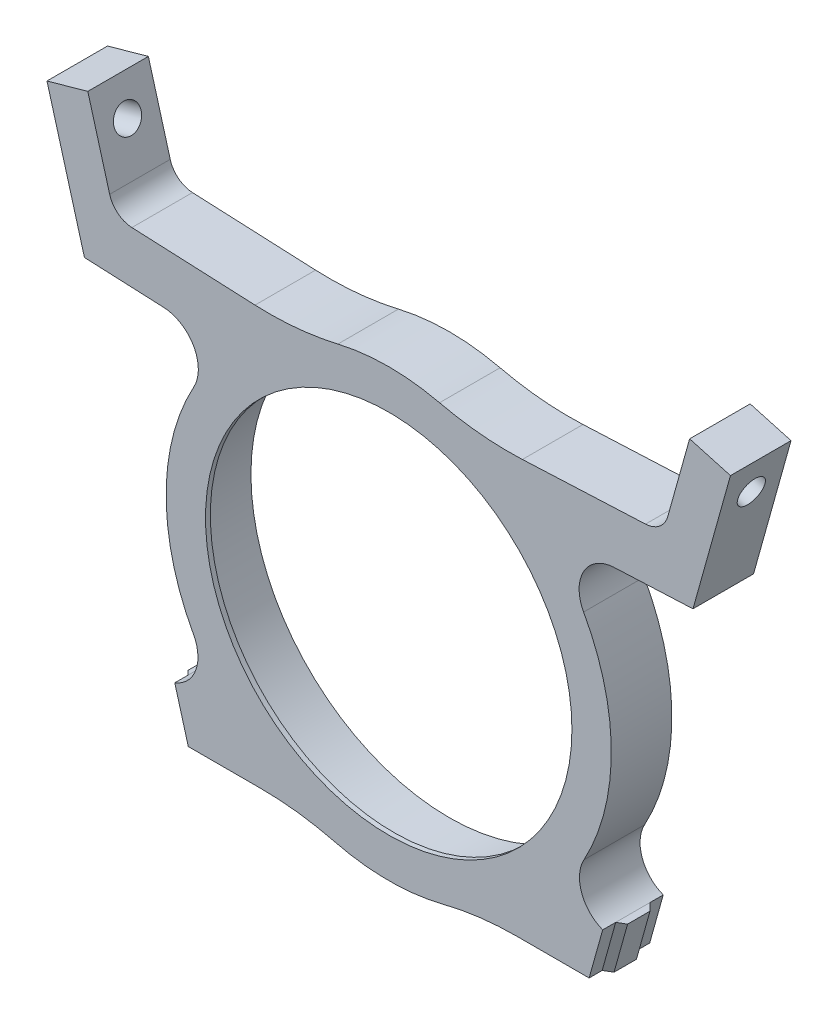
from build123d import *

# Parameters (mm, degrees)
SKIZZE1_R                       = 32.75
AUFSATZ_LINEAR_AUSTRAGEN1_DEPTH = 10
AUFSATZ_LINEAR_START            = -0.8
SKIZZE2_R                       = 32.75
SKIZZE2_R_2                     = 30.25
AUFSATZ_LINEAR_AUSTRAGEN2_DEPTH = 0.8
SKIZZE5_R                       = 2.25
SCHNITT_LINEAR_AUSTRAGEN1_DEPTH = 10
VERRUNDUNG1_R                   = 50
VERRUNDUNG2_R                   = 6
VERRUNDUNG3_R                   = 4
AUFSATZ_LINEAR_AUSTRAGEN3_DEPTH = 8.306468


with BuildPart() as part:
    # Skizze1 → Aufsatz-Linear austragen1 (new body)
    with BuildSketch(Plane.XY):
        with BuildLine():
            Line((-13.635878322, -34.12660725), (-33.089645956, -34.12660725))
            Line((-33.089645956, -34.12660725), (-35.325135331, -26.12660725))
            Line((-35.325135331, -26.12660725), (-25.844978112, -26.12660725))
            ThreePointArc((-25.844978112, -26.12660725), (-36.75, 0), (-25.844978112, 26.12660725))
            Line((-25.844978112, 26.12660725), (-50.235580292, 27.232429468))
            Line((-50.235580292, 27.232429468), (-52.656417654, 35.895722216))
            Line((-52.656417654, 35.895722216), (-56.424186432, 49.379190555))
            Line((-56.424186432, 49.379190555), (-49.682452262, 51.263074944))
            Line((-49.682452262, 51.263074944), (-45.294995525, 35.561969729))
            Line((-45.294995525, 35.561969729), (-13.635878322, 34.12660725))
            ThreePointArc((-13.635878322, 34.12660725), (0, 36.75), (13.635878322, 34.12660725))
            Line((13.635878322, 34.12660725), (45.294995525, 35.561969729))
            Line((45.294995525, 35.561969729), (49.682452262, 51.263074944))
            Line((49.682452262, 51.263074944), (56.424186432, 49.379190555))
            Line((56.424186432, 49.379190555), (52.656417654, 35.895722216))
            Line((52.656417654, 35.895722216), (50.235580292, 27.232429468))
            Line((50.235580292, 27.232429468), (25.844978112, 26.12660725))
            ThreePointArc((25.844978112, 26.12660725), (36.75, 0), (25.844978112, -26.12660725))
            Line((25.844978112, -26.12660725), (35.325135331, -26.12660725))
            Line((35.325135331, -26.12660725), (33.089645956, -34.12660725))
            Line((33.089645956, -34.12660725), (13.635878322, -34.12660725))
            ThreePointArc((13.635878322, -34.12660725), (0, -36.75), (-13.635878322, -34.12660725))
        make_face()
        Circle(SKIZZE1_R, mode=Mode.SUBTRACT)
    extrude(amount=AUFSATZ_LINEAR_AUSTRAGEN1_DEPTH)

    # Skizze2 → Aufsatz-Linear austragen2 (add)
    with BuildSketch(Plane.XY.offset(10).offset(AUFSATZ_LINEAR_START)):
        Circle(SKIZZE2_R)
        Circle(SKIZZE2_R_2, mode=Mode.SUBTRACT)
    extrude(amount=AUFSATZ_LINEAR_AUSTRAGEN2_DEPTH)

    # Skizze5 → Schnitt-Linear austragen1 (cut)
    with BuildSketch(Plane(origin=(32.796772797, -9.164604643, 0), x_dir=(0, 0, 1), z_dir=(-0.9631048813334842, 0.2691263412444341, 0))):
        with Locations(Location((5, 56.94978804, 0), (0, 0, 270))):
            Circle(SKIZZE5_R)
    schnitt_linear_austragen1 = extrude(amount=-SCHNITT_LINEAR_AUSTRAGEN1_DEPTH, mode=Mode.SUBTRACT)

    # Spiegeln1: Schnitt-Linear austragen1 across plane
    add(schnitt_linear_austragen1.mirror(Plane(origin=(0, 0, 0), x_dir=(0, 0, 1), z_dir=(1, 0, 0))), mode=Mode.SUBTRACT)

    # Verrundung1
    verrundung1_edges = [part.edges().sort_by_distance(p)[0] for p in [
        (13.635878322, 34.12660725, 5),
        (13.635878322, -34.12660725, 5),
        (-13.635878322, -34.12660725, 5),
        (-13.635878322, 34.12660725, 5),
    ]]
    fillet(verrundung1_edges, radius=VERRUNDUNG1_R)

    # Verrundung2
    # the kernel refuses this fillet: 6 mm, written as the material it adds along each edge
    with BuildSketch(Plane(origin=(-25.844978112, -26.12660725, 0), x_dir=(-1, 0, 0), z_dir=(0, 0, 1))) as verrundung2_piece_1:
        with BuildLine():
            CenterArc((11.651069987, -5.593490659), VERRUNDUNG2_R, 111.211936516, 97.493506366)
            Line((6.388466745, -8.475331584), (6.283214681, -8.532968403))
            ThreePointArc((6.283214681, -8.532968403), (3.405977683, -4.078058883), (-0.084391765, -0.085311371))
            Line((-0.084391765, -0.085311371), (0, 0.12))
            ThreePointArc((0, 0.12), (4.74007861, 0.12), (9.436738964, 0.111869813))
            Line((9.436738964, 0.111869813), (9.48015722, 0))
        make_face()
    extrude(amount=10)
    with BuildSketch(Plane(origin=(25.844978112, -26.12660725, 0), x_dir=(1, 0, 0), z_dir=(0, 0, 1))) as verrundung2_piece_2:
        with BuildLine():
            CenterArc((11.651069987, 5.593490659), VERRUNDUNG2_R, 151.294557118, 97.493506366)
            Line((6.388466745, 8.475331584), (6.283214681, 8.532968403))
            ThreePointArc((6.283214681, 8.532968403), (3.405977683, 4.078058883), (-0.084391765, 0.085311371))
            Line((-0.084391765, 0.085311371), (0, -0.12))
            ThreePointArc((0, -0.12), (4.74007861, -0.12), (9.436738964, -0.111869813))
            Line((9.436738964, -0.111869813), (9.48015722, 0))
        make_face()
    extrude(amount=10)
    with BuildSketch(Plane(origin=(25.844978112, 26.12660725, 0), x_dir=(0.603126946859045, -0.7976452130944475, 0), z_dir=(0, 0, 1))) as verrundung2_piece_3:
        with BuildLine():
            CenterArc((11.361383868, 5.938413704), VERRUNDUNG2_R, 145.501722428, 116.281978681)
            Line((6.416524574, 9.336702474), (6.317627388, 9.40466825))
            Line((6.317627388, 9.40466825), (-0.098897186, 0.067965775))
            Line((-0.098897186, 0.067965775), (0.017149259, -0.118768274))
            ThreePointArc((0.017149259, -0.118768274), (5.251960467, 0.257216064), (10.486771676, -0.118768274))
            Line((10.486771676, -0.118768274), (10.503920934, 0))
        make_face()
    extrude(amount=10)
    with BuildSketch(Plane(origin=(-25.844978112, 26.12660725, 0), x_dir=(-0.6031269468590452, -0.7976452130944475, 0), z_dir=(0, 0, 1))) as verrundung2_piece_4:
        with BuildLine():
            CenterArc((11.361383868, -5.938413704), VERRUNDUNG2_R, 98.216298891, 116.281978681)
            Line((6.416524574, -9.336702474), (6.317627388, -9.40466825))
            Line((6.317627388, -9.40466825), (-0.098897186, -0.067965775))
            Line((-0.098897186, -0.067965775), (0.017149259, 0.118768274))
            ThreePointArc((0.017149259, 0.118768274), (5.251960467, -0.257216064), (10.486771676, 0.118768274))
            Line((10.486771676, 0.118768274), (10.503920934, 0))
        make_face()
    extrude(amount=10)

    # Verrundung3
    verrundung3_edges = [part.edges().sort_by_distance(p)[0] for p in [
        (45.294995525, 35.561969729, 5),
        (-45.294995525, 35.561969729, 5),
    ]]
    fillet(verrundung3_edges, radius=VERRUNDUNG3_R)

    # Skizze6 → Aufsatz-Linear austragen3 (add)
    with BuildSketch(Plane(origin=(6.448861011, -23.078118218, 0), x_dir=(0, 0, -1), z_dir=(-0.26912634124443396, 0.9631048813334842, 0))):
        Polygon((-7.85, 41.05316849), (-6.85, 42.05316849), (-3.15, 42.05316849), (-2.15, 41.05316849), align=None)
    aufsatz_linear_austragen3 = extrude(amount=AUFSATZ_LINEAR_AUSTRAGEN3_DEPTH)

    # Spiegeln2: Aufsatz-Linear austragen3 across plane
    add(aufsatz_linear_austragen3.mirror(Plane(origin=(0, 0, 0), x_dir=(0, 0, 1), z_dir=(1, 0, 0))))


solid = part.part
